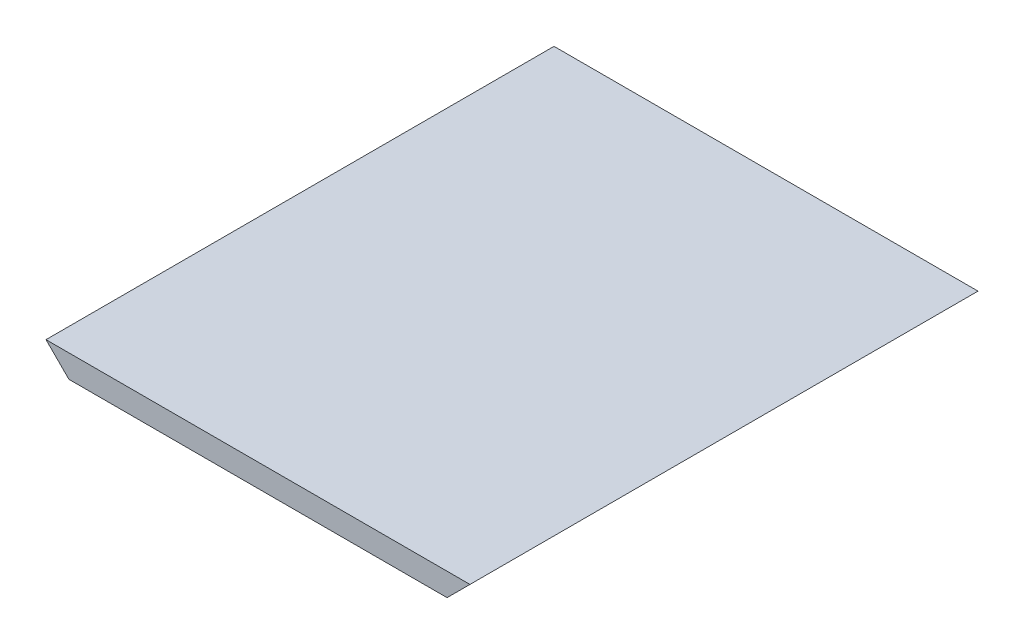
from build123d import *

# Parameters (mm, degrees)
SKETCH1_W           = 111
SKETCH1_H           = 133
BOSS_EXTRUDE1_DEPTH = 6
CHAMFER1_SIZE       = 6


with BuildPart() as part:
    # Sketch1 → Boss-Extrude1 (new body)
    with BuildSketch(Plane(origin=(0, 0, 0), x_dir=(1, 0, 0), z_dir=(0, 1, 0))):
        Rectangle(SKETCH1_W, SKETCH1_H)
    extrude(amount=BOSS_EXTRUDE1_DEPTH)

    # Chamfer1
    chamfer1_edges = [part.edges().sort_by_distance(p)[0] for p in [
        (55.5, 0, 0),
        (-55.5, 0, 0),
    ]]
    chamfer(chamfer1_edges, length=CHAMFER1_SIZE - 0.0001)  # a hair under: the kernel refuses the full size


solid = part.part
